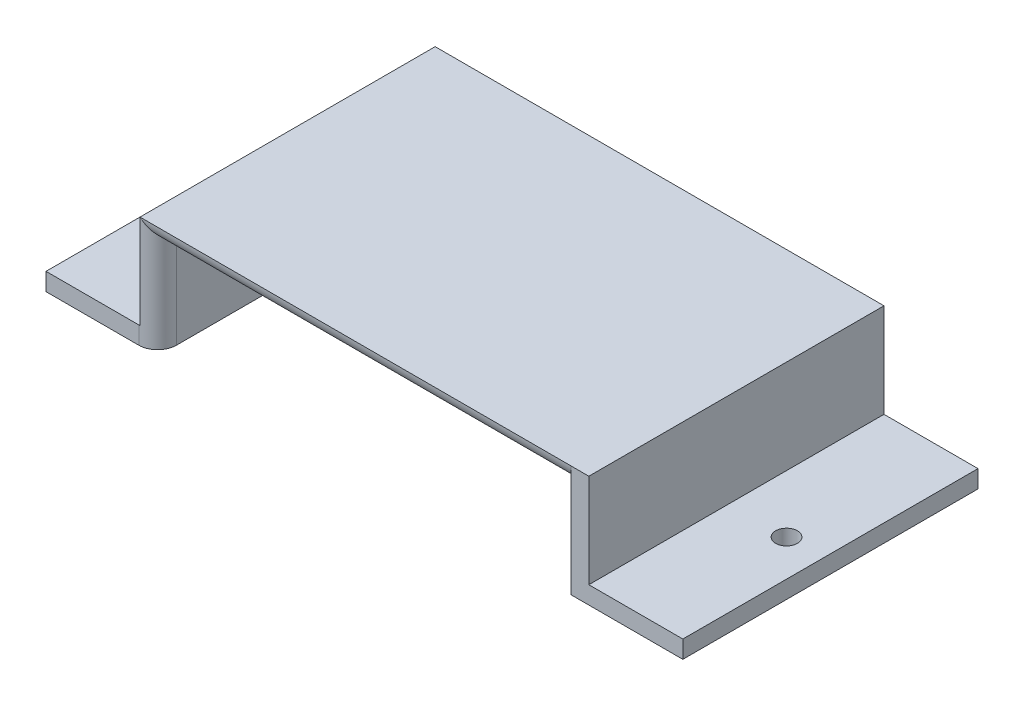
from build123d import *

# Parameters (mm, degrees)
BOSS_EXTRUDE1_DEPTH   = 39.878
F_4_CLEARANCE_HOLE1_D = 2.9464
FILLET1_R             = 2.54
FILLET2_R             = 2.54


with BuildPart() as part:
    # Sketch1 → Boss-Extrude1 (new body)
    with BuildSketch(Plane.XY):
        Polygon((-43.02125, 0), (-30.32125, 0), (-30.32125, 12.7), (30.32125, 12.7), (30.32125, 0), (43.02125, 0), (43.02125, -2.38125), (27.94, -2.38125), (27.94, 10.31875), (-27.94, 10.31875), (-27.94, -2.38125), (-43.02125, -2.38125), align=None)
    extrude(amount=BOSS_EXTRUDE1_DEPTH)

    # #4 Clearance Hole1 (through all)
    with Locations(Plane(origin=(0, 0, 0), x_dir=(1, 0, 0), z_dir=(0, 1, 0))):
        with Locations((-38.1, -20.948579073)):
            f_4_clearance_hole1 = Hole(F_4_CLEARANCE_HOLE1_D / 2)

    # Mirror1: #4 Clearance Hole1 across plane
    add(f_4_clearance_hole1.mirror(Plane(origin=(0, 0, 0), x_dir=(0, 0, 1), z_dir=(1, 0, 0))), mode=Mode.SUBTRACT)

    # Fillet1
    # the kernel refuses this fillet: 2.54 mm, written as the material it takes off along each edge
    with BuildSketch(Plane(origin=(-27.94, 10.31875, 39.878), x_dir=(-1, 0, 0), z_dir=(0, -1, 0))) as fillet1_piece_1:
        with BuildLine():
            CenterArc((FILLET1_R, FILLET1_R), FILLET1_R, 180, 90)
            Line((0, FILLET1_R), (0, 0))
            Line((0, 0), (FILLET1_R, 0))
        make_face()
    extrude(amount=19.05, mode=Mode.SUBTRACT)

    # Fillet2
    # the kernel refuses this fillet: 2.54 mm, written as the material it takes off along each edge
    with BuildSketch(Plane(origin=(27.94, 10.31875, 39.878), x_dir=(0, 0, -1), z_dir=(-1, 0, 0))) as fillet2_piece_1_section:
        with BuildLine():
            CenterArc((2.535034208, -2.54), FILLET2_R, 90, 86.416678302)
            Line((0, -2.38125), (0, 0))
            Line((0, 0), (2.535034208, 0))
        make_face()
    fillet2_piece_1 = extrude(amount=64.598835521, mode=Mode.PRIVATE)
    fillet2_piece_1 = fillet2_piece_1 - Plane(origin=(-30.48, 11.003720119, 37.338), x_dir=(-1, 0, 0), z_dir=(0, 1, 0)) * Cylinder(2.54, 140, mode=Mode.PRIVATE)
    add(fillet2_piece_1, mode=Mode.SUBTRACT)


solid = part.part
